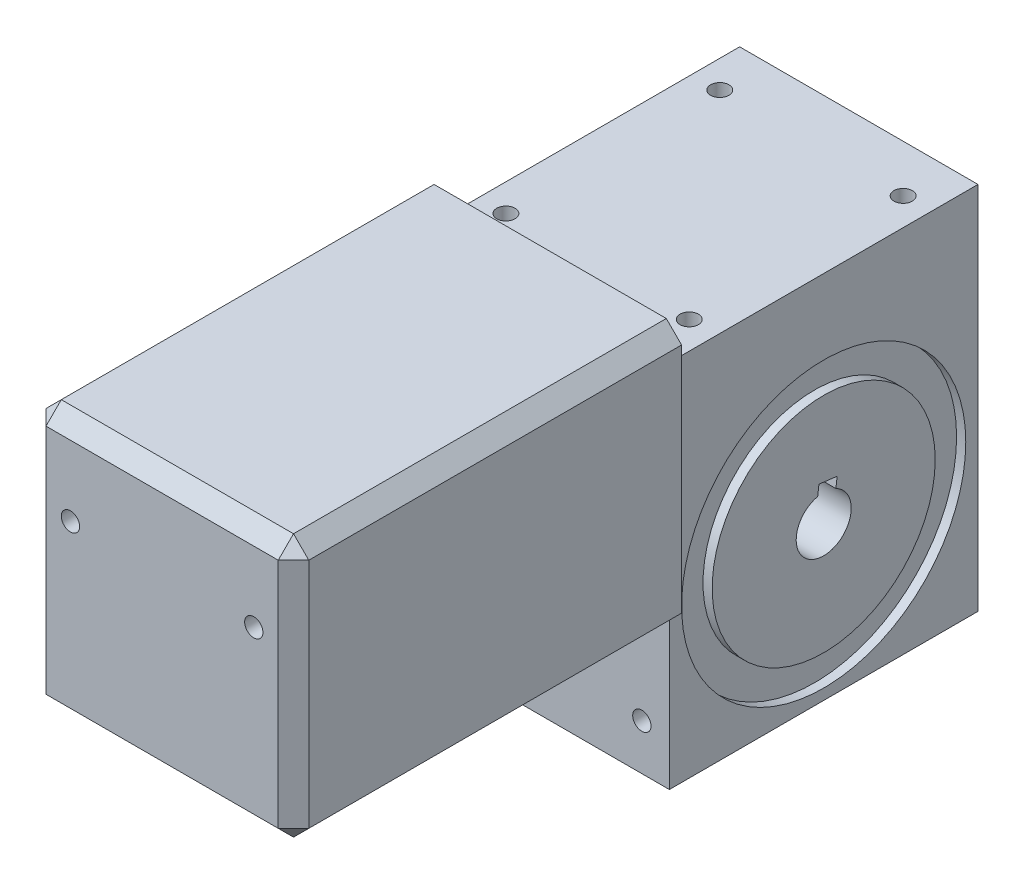
from build123d import *

# Parameters (mm, degrees)
SKETCH_1_W               = 78
SKETCH_1_H               = 101
EXTRUDE_1_DEPTH          = 121
SKETCH_4_W               = 86
SKETCH_4_H               = 86
EXTRUDE_2_DEPTH          = 127
CUT_EXTRUDE_1_DEPTH      = 189.857088826
CUT_EXTRUDE_1_DEPTH_BACK = 189.857088826
SKETCH_5_R               = 7
CHAMFER_1_SIZE           = 5
CUT_EXTRUDE_2_REACH      = 269.436
SKETCH_6_R               = 3
SKETCH_7_R               = 3
CUT_EXTRUDE_3_DEPTH      = 181.607308822
SKETCH_8_R               = 46.5
SKETCH_8_R_2             = 36.5
CUT_EXTRUDE_1_2_DEPTH    = 3
CUT_EXTRUDE_START        = -3
SKETCH_9_R               = 46.5
SKETCH_9_R_2             = 36.5
CUT_EXTRUDE_2_2_DEPTH    = 3
KEYWAY_DEPTH             = 214.350603768


with BuildPart() as part:
    # 草图1 → 凸台-拉伸1 (new body)
    with BuildSketch(Plane(origin=(0, 0, 0), x_dir=(1, 0, 0), z_dir=(0, 1, 0))):
        with Locations((0, 50.5)):
            Rectangle(SKETCH_1_W, SKETCH_1_H)
    extrude(amount=EXTRUDE_1_DEPTH)

    # 草图4 → 凸台-拉伸2 (add)
    with BuildSketch(Plane.XY):
        with Locations((0, 90)):
            Rectangle(SKETCH_4_W, SKETCH_4_H)
    extrude(amount=EXTRUDE_2_DEPTH)

    # 草图5 → Cut-Extrude 1 (cut, two sides: drawn at the far end of the back side and taken through both)
    with BuildSketch(Plane(origin=(0, 0, 0), x_dir=(0, 0, -1), z_dir=(1, 0, 0)).offset(-CUT_EXTRUDE_1_DEPTH_BACK)):
        with Locations(Location((50.5, 50, 0), (0, 0, 180))):
            Circle(SKETCH_5_R)
    extrude(amount=CUT_EXTRUDE_1_DEPTH + CUT_EXTRUDE_1_DEPTH_BACK, mode=Mode.SUBTRACT)

    # 倒角1
    # the kernel refuses this chamfer: 5 mm, written as the material it takes off along each edge
    with BuildSketch(Plane(origin=(39.666666667, 50.333333333, 123.666666667), x_dir=(0.7071067811865475, -2.009718347115232e-15, -0.7071067811865475), z_dir=(0.5773502691896247, -0.5773502691896264, 0.5773502691896264)), Plane(origin=(39.666666667, 129.666666667, 123.666666667), x_dir=(-0.7071067811865475, 2.009718347115232e-15, 0.7071067811865475), z_dir=(0.5773502691896272, 0.5773502691896246, 0.5773502691896255))) as chamfer_1_piece_1:
        Polygon((-3.535533906, 2.041241452), (3.535533906, 2.041241452), (0, -4.082482905), align=None)
    extrude(amount=6.350852961, mode=Mode.SUBTRACT)
    with BuildSketch(Plane(origin=(-39.666666667, 129.666666667, 123.666666667), x_dir=(0.7071067811865475, 0, 0.7071067811865475), z_dir=(-0.5773502691896257, 0.5773502691896257, 0.5773502691896257)), Plane(origin=(-39.666666667, 50.333333333, 123.666666667), x_dir=(-0.7071067811865475, 0, -0.7071067811865475), z_dir=(-0.5773502691896261, -0.5773502691896253, 0.5773502691896261))) as chamfer_1_piece_2:
        Polygon((-3.535533906, -2.041241452), (3.535533906, -2.041241452), (0, 4.082482905), align=None)
    extrude(amount=6.350852961, mode=Mode.SUBTRACT)
    with BuildSketch(Plane(origin=(43, 47, 0), x_dir=(-0.9996219169112968, -0.027495876610586317, 0), z_dir=(0, 0, 1))) as chamfer_1_piece_3:
        Polygon((CHAMFER_1_SIZE * 0.999621916911, -CHAMFER_1_SIZE * 0.0274958766106), (-CHAMFER_1_SIZE * 0.0274958766106, -CHAMFER_1_SIZE * 0.999621916911), (0, 0), align=None)
    extrude(amount=139.85841494, mode=Mode.SUBTRACT)
    with BuildSketch(Plane(origin=(43, 133, -12.85841494), x_dir=(0.027495876610586206, -0.9996219169112968, 0), z_dir=(0, 0, 1))) as chamfer_1_piece_4:
        Polygon((CHAMFER_1_SIZE * 0.999621916911, -CHAMFER_1_SIZE * 0.0274958766106), (-CHAMFER_1_SIZE * 0.0274958766106, -CHAMFER_1_SIZE * 0.999621916911), (0, 0), align=None)
    extrude(amount=152.71682988, mode=Mode.SUBTRACT)
    with BuildSketch(Plane(origin=(-43, 133, -12.85841494), x_dir=(-0.027495876610586355, -0.9996219169112968, 0), z_dir=(0, 0, 1))) as chamfer_1_piece_5:
        Polygon((CHAMFER_1_SIZE * 0.999621916911, CHAMFER_1_SIZE * 0.0274958766106), (-CHAMFER_1_SIZE * 0.0274958766106, CHAMFER_1_SIZE * 0.999621916911), (0, 0), align=None)
    extrude(amount=152.71682988, mode=Mode.SUBTRACT)
    with BuildSketch(Plane(origin=(-43, 47, 0), x_dir=(0.9996219169112968, -0.027495876610586355, 0), z_dir=(0, 0, 1))) as chamfer_1_piece_6:
        Polygon((CHAMFER_1_SIZE * 0.999621916911, CHAMFER_1_SIZE * 0.0274958766106), (-CHAMFER_1_SIZE * 0.0274958766106, CHAMFER_1_SIZE * 0.999621916911), (0, 0), align=None)
    extrude(amount=139.85841494, mode=Mode.SUBTRACT)
    with BuildSketch(Plane(origin=(43, 145.85841494, 127), x_dir=(0.027495876610586282, 0, -0.9996219169112968), z_dir=(0, -1, 0)), Plane(origin=(-43, 34.14158506, 127), x_dir=(-0.027495876610586282, 0, -0.9996219169112968), z_dir=(0, 1, 0)), Plane(origin=(55.85841494, 47, 127), x_dir=(0, -0.027495876610586282, -0.9996219169112968), z_dir=(-1, 0, 0))) as chamfer_1_piece_7:
        Polygon((CHAMFER_1_SIZE * 0.999621916911, -CHAMFER_1_SIZE * 0.0274958766106), (-CHAMFER_1_SIZE * 0.0274958766106, -CHAMFER_1_SIZE * 0.999621916911), (0, 0), align=None)
    extrude(amount=111.71682988, mode=Mode.SUBTRACT)
    with BuildSketch(Plane(origin=(-55.85841494, 133, 127), x_dir=(0, -0.9996219169112968, 0.027495876610587663), z_dir=(1, 0, 0))) as chamfer_1_piece_8:
        Polygon((CHAMFER_1_SIZE * 0.999621916911, CHAMFER_1_SIZE * 0.0274958766106), (-CHAMFER_1_SIZE * 0.0274958766106, CHAMFER_1_SIZE * 0.999621916911), (0, 0), align=None)
    extrude(amount=111.71682988, mode=Mode.SUBTRACT)

    # 草图6 → Cut-Extrude 2 (cut, up to next)
    with BuildSketch(Plane(origin=(0, 0, -101), x_dir=(-1, 0, 0), z_dir=(0, 0, -1)), mode=Mode.PRIVATE) as cut_extrude_2_sk1:
        with Locations((-30, 15)):
            Circle(SKETCH_6_R)
    cut_extrude_2_tool1 = extrude(cut_extrude_2_sk1.sketch, amount=-CUT_EXTRUDE_2_REACH, mode=Mode.PRIVATE) & part.part
    # 草图6 → Cut-Extrude 2 (cut, up to next)
    with BuildSketch(Plane(origin=(0, 0, -101), x_dir=(-1, 0, 0), z_dir=(0, 0, -1)), mode=Mode.PRIVATE) as cut_extrude_2_sk2:
        with Locations((30, 15)):
            Circle(SKETCH_6_R)
    cut_extrude_2_tool2 = extrude(cut_extrude_2_sk2.sketch, amount=-CUT_EXTRUDE_2_REACH, mode=Mode.PRIVATE) & part.part
    # 草图6 → Cut-Extrude 2 (cut, up to next)
    with BuildSketch(Plane(origin=(0, 0, -101), x_dir=(-1, 0, 0), z_dir=(0, 0, -1)), mode=Mode.PRIVATE) as cut_extrude_2_sk3:
        with Locations((-30, 105)):
            Circle(SKETCH_6_R)
    cut_extrude_2_tool3 = extrude(cut_extrude_2_sk3.sketch, amount=-CUT_EXTRUDE_2_REACH, mode=Mode.PRIVATE) & part.part
    # 草图6 → Cut-Extrude 2 (cut, up to next)
    with BuildSketch(Plane(origin=(0, 0, -101), x_dir=(-1, 0, 0), z_dir=(0, 0, -1)), mode=Mode.PRIVATE) as cut_extrude_2_sk4:
        with Locations((30, 105)):
            Circle(SKETCH_6_R)
    cut_extrude_2_tool4 = extrude(cut_extrude_2_sk4.sketch, amount=-CUT_EXTRUDE_2_REACH, mode=Mode.PRIVATE) & part.part
    add(cut_extrude_2_tool1.solids().sort_by_distance((30, 15, -101))[0], mode=Mode.SUBTRACT)
    add(cut_extrude_2_tool2.solids().sort_by_distance((-30, 15, -101))[0], mode=Mode.SUBTRACT)
    add(cut_extrude_2_tool3.solids().sort_by_distance((30, 105, -101))[0], mode=Mode.SUBTRACT)
    add(cut_extrude_2_tool4.solids().sort_by_distance((-30, 105, -101))[0], mode=Mode.SUBTRACT)

    # 草图7 → 切除-拉伸3 (cut, through all)
    with BuildSketch(Plane(origin=(0, 121, 0), x_dir=(1, 0, 0), z_dir=(0, 1, 0))):
        with Locations((30, 85.5)):
            Circle(SKETCH_7_R)
        with Locations((30, 15.5)):
            Circle(SKETCH_7_R)
        with Locations((-30, 15.5)):
            Circle(SKETCH_7_R)
        with Locations((-30, 85.5)):
            Circle(SKETCH_7_R)
    extrude(amount=-CUT_EXTRUDE_3_DEPTH, mode=Mode.SUBTRACT)

    # 草图8 → Cut-Extrude 1 2 (cut)
    with BuildSketch(Plane.ZY.offset(39)):
        with Locations((-50.5, 50)):
            Circle(SKETCH_8_R)
        with Locations((-50.5, 50)):
            Circle(SKETCH_8_R_2, mode=Mode.SUBTRACT)
    extrude(amount=-CUT_EXTRUDE_1_2_DEPTH, mode=Mode.SUBTRACT)

    # 草图9 → Cut-Extrude 2 2 (cut)
    with BuildSketch(Plane(origin=(39, 0, 0), x_dir=(0, 0, -1), z_dir=(1, 0, 0)).offset(CUT_EXTRUDE_START)):
        with Locations((50.5, 50)):
            Circle(SKETCH_9_R)
        with Locations((50.5, 50)):
            Circle(SKETCH_9_R_2, mode=Mode.SUBTRACT)
    extrude(amount=CUT_EXTRUDE_2_2_DEPTH, mode=Mode.SUBTRACT)

    # KeySketch → Keyway (cut, through all)
    with BuildSketch(Plane(origin=(-39, 56.979737296, -54.70140282), x_dir=(0, 0, 1), z_dir=(-1, 0, 0))):
        with BuildLine():
            Line((0.196955351, 1.08031236), (-0.204032077, 4.370687514))
            Line((-0.204032077, 4.370687514), (5.7519036, 5.096518221))
            Line((5.7519036, 5.096518221), (6.152891028, 1.806143068))
            ThreePointArc((6.152891028, 1.806143068), (5.290148882, -15.913640811), (0.196955351, 1.08031236))
        make_face()
    extrude(amount=-KEYWAY_DEPTH, mode=Mode.SUBTRACT)


solid = part.part
